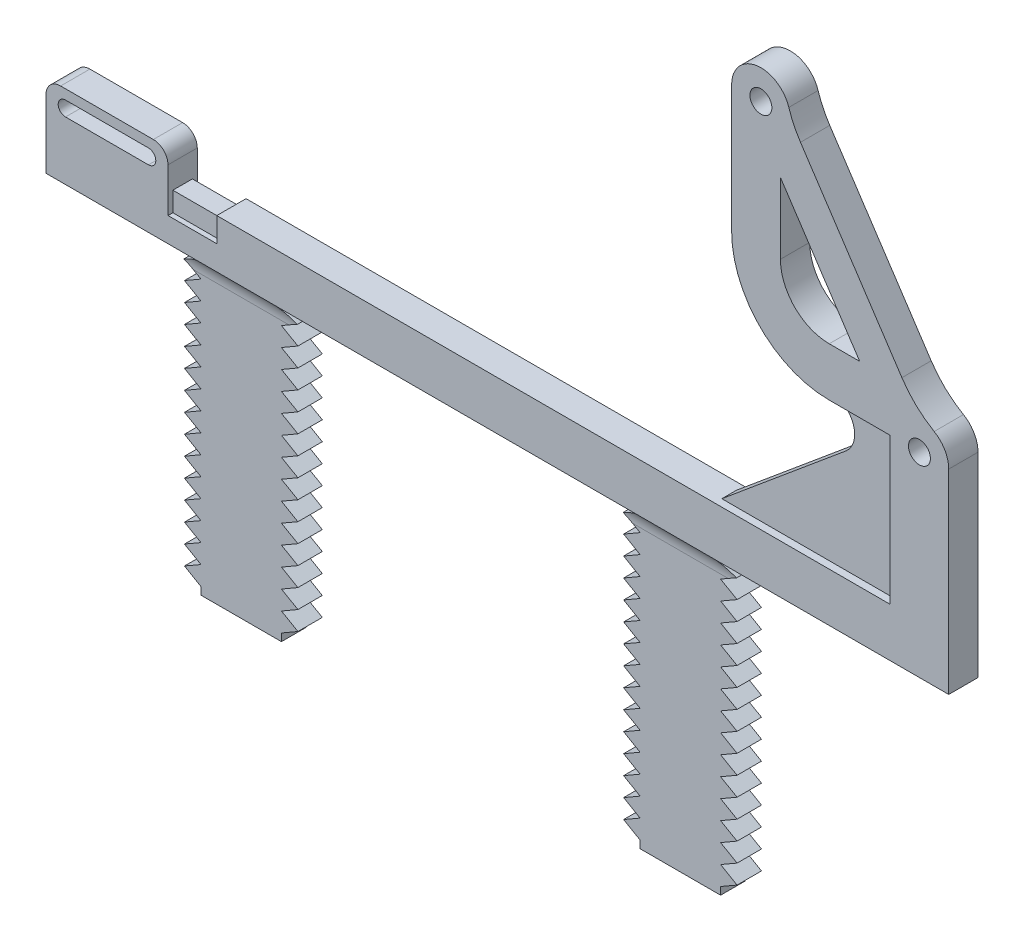
from build123d import *

# Parameters (mm, degrees)
SKETCH1_R           = 2.25
BOSS_EXTRUDE1_DEPTH = 6
BOSS_EXTRUDE2_DEPTH = 6
FILLET1_R           = 3
BOSS_EXTRUDE3_START = -4.5
BOSS_EXTRUDE3_DEPTH = 3
CUT_EXTRUDE1_DEPTH  = 10
FILLET2_R           = 20
FILLET3_R           = 5
FILLET4_R           = 20
FILLET5_R           = 10
BOSS_EXTRUDE5_DEPTH = 5
LPATTERN1_COUNT     = 2
LPATTERN1_PITCH     = 90
FILLET6_R           = 5


with BuildPart() as part:
    # Sketch1 → Boss-Extrude1 (new body)
    with BuildSketch(Plane.XY):
        with BuildLine():
            Line((-6, 0), (-6, -40))
            Line((-6, -40), (6, -40))
            Line((6, -40), (6, 0))
            ThreePointArc((6, 0), (4.242640687, 4.242640687), (0, 6))
            Line((0, 6), (-26.49, 46))
            ThreePointArc((-26.49, 46), (-32.49, 52), (-38.49, 46))
            Line((-38.49, 46), (-38.49, 0))
            Line((-38.49, 0), (-6, 0))
        make_face()
        Circle(SKETCH1_R, mode=Mode.SUBTRACT)
        with Locations((-32.49, 46)):
            Circle(SKETCH1_R, mode=Mode.SUBTRACT)
        Polygon((-28.49, 34.531145288), (-12.244249033, 10), (-28.49, 10), align=None, mode=Mode.SUBTRACT)
    extrude(amount=BOSS_EXTRUDE1_DEPTH)

    # Sketch2 → Boss-Extrude2 (add)
    with BuildSketch(Plane.XY):
        Polygon((6, -40), (-179, -40), (-179, -30), (-179, -23), (-154, -23), (-154, -30), (6, -30), align=None)
        with BuildLine():
            Line((-175, -25), (-158, -25))
            ThreePointArc((-158, -25), (-156.5, -26.5), (-158, -28))
            Line((-158, -28), (-175, -28))
            ThreePointArc((-175, -28), (-176.5, -26.5), (-175, -25))
        make_face(mode=Mode.SUBTRACT)
    extrude(amount=BOSS_EXTRUDE2_DEPTH)

    # Fillet1
    fillet1_edges = [part.edges().sort_by_distance(p)[0] for p in [
        (-154, -23, 3),
        (-179, -23, 3),
    ]]
    fillet(fillet1_edges, radius=FILLET1_R)

    # Sketch3 → Boss-Extrude3 (add)
    with BuildSketch(Plane.XY.offset(6).offset(BOSS_EXTRUDE3_START)):
        Polygon((-6, 0), (-42, -30), (-6, -30), align=None)
    extrude(amount=BOSS_EXTRUDE3_DEPTH)

    # Sketch4 → Cut-Extrude1 (cut)
    with BuildSketch(Plane(origin=(-154, 0, 0), x_dir=(0, 0, -1), z_dir=(1, 0, 0))):
        Polygon((-6, -30), (0, -30), (0, -35), (0, -40), (-1, -40), (-1, -34), (-1, -31), (-5, -31), (-5, -34), (-5, -35), (-6, -35), align=None)
    extrude(amount=CUT_EXTRUDE1_DEPTH, mode=Mode.SUBTRACT)

    # Fillet2
    fillet2_edges = [part.edges().sort_by_distance(p)[0] for p in [
        (-38.49, 0, 3),
    ]]
    fillet(fillet2_edges, radius=FILLET2_R)

    # Fillet3
    # the kernel refuses this fillet: 5 mm, written as the material it adds along each edge
    with BuildSketch(Plane(origin=(-6, 0, 1.5), x_dir=(-0.9999981113094557, 0.0019435476638204458, 0), z_dir=(0, 0, 1))) as fillet3_piece_1:
        with BuildLine():
            CenterArc((13.76117003, 4.993921829), FILLET3_R, 129.916928241, 137.257651262)
            Line((10.552788704, 8.828799828), (10.231950571, 9.212287628))
            Line((10.231950571, 9.212287628), (-0.320838133, 0.3834878))
            Line((-0.320838133, 0.3834878), (0.000971774, -0.499999056))
            ThreePointArc((0.000971774, -0.499999056), (12.490948184, -0.475724145), (13.490059043, -0.499392183))
            Line((13.490059043, -0.499392183), (13.514705497, 0))
        make_face()
    extrude(amount=3)

    # Fillet4
    fillet4_edges = [part.edges().sort_by_distance(p)[0] for p in [
        (-26.49, 46, 3),
        (0, 6, 3),
    ]]
    fillet(fillet4_edges, radius=FILLET4_R)

    # Fillet5
    fillet5_edges = [part.edges().sort_by_distance(p)[0] for p in [
        (-28.49, 10, 3),
    ]]
    fillet(fillet5_edges, radius=FILLET5_R)

    # Sketch5 → Boss-Extrude5 (add)
    with BuildSketch(Plane.XY):
        Polygon((-58.25, -40), (-61.625, -41.948557159), (-58.25, -43.897114317), (-61.625, -45.845671476), (-58.25, -47.794228634), (-61.625, -49.742785793), (-58.25, -51.691342951), (-61.625, -53.63990011), (-58.25, -55.588457268), (-61.625, -57.537014427), (-58.25, -59.485571585), (-61.625, -61.434128744), (-58.25, -63.382685902), (-61.625, -65.331243061), (-58.25, -67.279800219), (-61.625, -69.228357378), (-58.25, -71.176914536), (-61.625, -73.125471695), (-58.25, -75.074028853), (-61.625, -77.022586012), (-58.25, -78.97114317), (-61.625, -80.919700329), (-58.25, -82.868257487), (-61.625, -84.816814646), (-58.25, -86.765371804), (-61.625, -88.713928963), (-58.25, -90.662486121), (-61.625, -92.61104328), (-58.25, -94.559600438), (-61.625, -96.508157597), (-58.25, -98.456714755), (-58.25, -100), (-41.75, -100), (-41.75, -98.456714755), (-38.375, -96.508157597), (-41.75, -94.559600438), (-38.375, -92.61104328), (-41.75, -90.662486121), (-38.375, -88.713928963), (-41.75, -86.765371804), (-38.375, -84.816814646), (-41.75, -82.868257487), (-38.375, -80.919700329), (-41.75, -78.97114317), (-38.375, -77.022586012), (-41.75, -75.074028853), (-38.375, -73.125471695), (-41.75, -71.176914536), (-38.375, -69.228357378), (-41.75, -67.279800219), (-38.375, -65.331243061), (-41.75, -63.382685902), (-38.375, -61.434128744), (-41.75, -59.485571585), (-38.375, -57.537014427), (-41.75, -55.588457268), (-38.375, -53.63990011), (-41.75, -51.691342951), (-38.375, -49.742785793), (-41.75, -47.794228634), (-38.375, -45.845671476), (-41.75, -43.897114317), (-38.375, -41.948557159), (-41.75, -40), align=None)
    boss_extrude5 = extrude(amount=BOSS_EXTRUDE5_DEPTH)

    # LPattern1: Boss-Extrude5 ×2
    with Locations(*[(-i * LPATTERN1_PITCH, 0, 0) for i in range(1, LPATTERN1_COUNT)]):
        add(boss_extrude5)

    # Fillet6
    # the kernel refuses this fillet: 5 mm, written as the material it adds along each edge
    with BuildSketch(Plane(origin=(-34.25, -40, 5), x_dir=(0, 0, 1), z_dir=(-1, 0, 0))) as fillet6_piece_1_section:
        with BuildLine():
            CenterArc((5, -3), FILLET6_R, 143.130102354, 36.869897646)
            Line((0, -3), (-0.1, -3))
            Line((-0.1, -3), (-0.1, 0))
            Line((-0.1, 0), (0, 0.1))
            ThreePointArc((0, 0.1), (0.5, 0.1), (0.92, 0.06))
            Line((0.92, 0.06), (1, 0))
        make_face()
    fillet6_piece_1 = extrude(amount=31.5, mode=Mode.PRIVATE)
    fillet6_piece_1 = split(fillet6_piece_1, bisect_by=Plane(origin=(-52.46109118, -36.657771935, 5.210901553), z_dir=(0.4999999999999993, -0.8660254037844392, 0)), keep=Keep.TOP, mode=Mode.PRIVATE)
    fillet6_piece_1 = split(fillet6_piece_1, bisect_by=Plane(origin=(-47.53890882, -36.657771935, 5.210901553), z_dir=(-0.5000000000000001, -0.8660254037844387, 0)), keep=Keep.TOP, mode=Mode.PRIVATE)
    fillet6_piece_1 = split(fillet6_piece_1, bisect_by=Plane(origin=(-53.35140882, -46.725317253, 5.210901553), z_dir=(0.5000000000000007, 0.8660254037844384, 0)), keep=Keep.TOP, mode=Mode.PRIVATE)
    fillet6_piece_1 = split(fillet6_piece_1, bisect_by=Plane(origin=(-46.64859118, -46.725317253, 5.210901553), z_dir=(-0.5000000000000022, 0.8660254037844374, 0)), keep=Keep.TOP, mode=Mode.PRIVATE)
    add(fillet6_piece_1)
    with BuildSketch(Plane(origin=(-124.25, -40, 5), x_dir=(0, 0, 1), z_dir=(-1, 0, 0))) as fillet6_piece_2_section:
        with BuildLine():
            CenterArc((5, -3), FILLET6_R, 143.130102354, 36.869897646)
            Line((0, -3), (-0.1, -3))
            Line((-0.1, -3), (-0.1, 0))
            Line((-0.1, 0), (0, 0.1))
            ThreePointArc((0, 0.1), (0.5, 0.1), (0.92, 0.06))
            Line((0.92, 0.06), (1, 0))
        make_face()
    fillet6_piece_2 = extrude(amount=31.5, mode=Mode.PRIVATE)
    fillet6_piece_2 = split(fillet6_piece_2, bisect_by=Plane(origin=(-142.46109118, -36.657771935, 5.210901553), z_dir=(0.4999999999999993, -0.8660254037844392, 0)), keep=Keep.TOP, mode=Mode.PRIVATE)
    fillet6_piece_2 = split(fillet6_piece_2, bisect_by=Plane(origin=(-137.53890882, -36.657771935, 5.210901553), z_dir=(-0.5000000000000001, -0.8660254037844387, 0)), keep=Keep.TOP, mode=Mode.PRIVATE)
    fillet6_piece_2 = split(fillet6_piece_2, bisect_by=Plane(origin=(-143.35140882, -46.725317253, 5.210901553), z_dir=(0.5000000000000007, 0.8660254037844384, 0)), keep=Keep.TOP, mode=Mode.PRIVATE)
    fillet6_piece_2 = split(fillet6_piece_2, bisect_by=Plane(origin=(-136.64859118, -46.725317253, 5.210901553), z_dir=(-0.5000000000000022, 0.8660254037844374, 0)), keep=Keep.TOP, mode=Mode.PRIVATE)
    add(fillet6_piece_2)


solid = part.part
